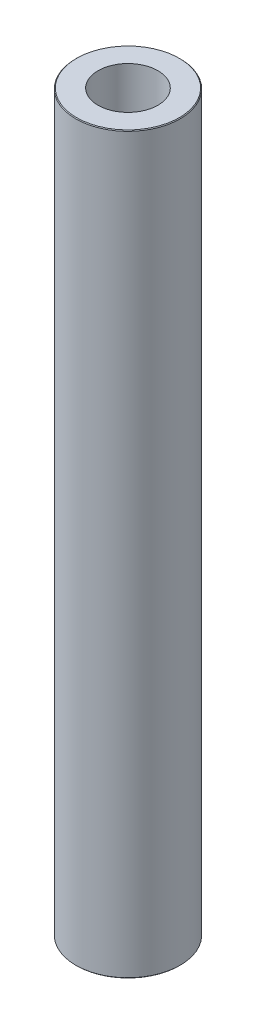
from build123d import *

# Parameters (mm, degrees)
SKETCH1_R           = 35
BOSS_EXTRUDE1_DEPTH = 493.163189732
SKETCH2_R           = 20.119308325
CUT_EXTRUDE1_DEPTH  = 496.640930217
CHAMFER1_SIZE       = 0.485913605


with BuildPart() as part:
    # Sketch1 → Boss-Extrude1 (new body)
    with BuildSketch(Plane(origin=(0, 0, 0), x_dir=(1, 0, 0), z_dir=(0, 1, 0))):
        Circle(SKETCH1_R)
    extrude(amount=BOSS_EXTRUDE1_DEPTH)

    # Sketch2 → Cut-Extrude1 (cut, through all)
    with BuildSketch(Plane(origin=(0, 0, 0), x_dir=(1, 0, 0), z_dir=(0, 1, 0))):
        Circle(SKETCH2_R)
    extrude(amount=CUT_EXTRUDE1_DEPTH, mode=Mode.SUBTRACT)

    # Chamfer1
    chamfer1_edges = [part.edges().sort_by_distance(p)[0] for p in [
        (-35, 493.163189732, 0),
        (-35, 0, 0),
    ]]
    chamfer(chamfer1_edges, length=CHAMFER1_SIZE)


solid = part.part
